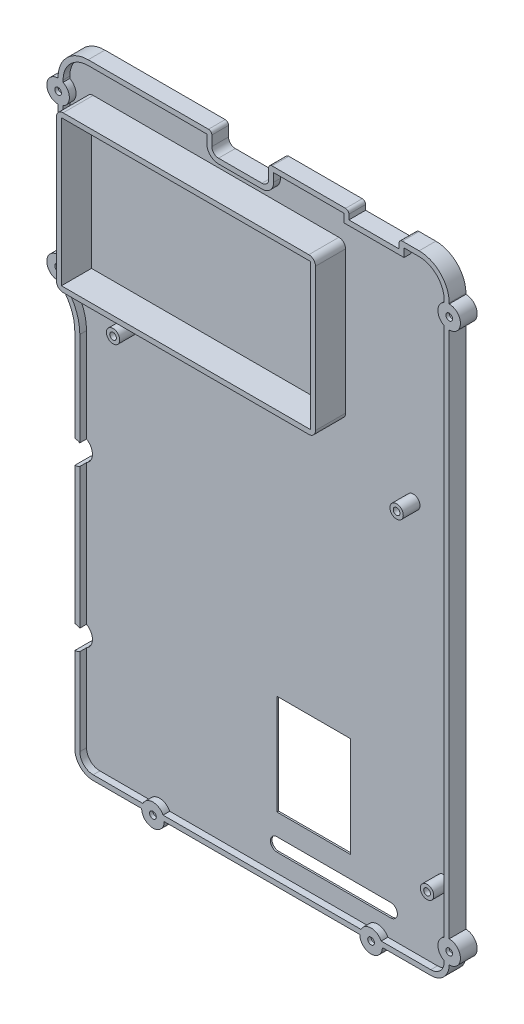
from build123d import *
from OCP.BRepAlgoAPI import BRepAlgoAPI_Cut
from OCP.TopTools import TopTools_ListOfShape

# Parameters (mm, degrees)
BOSS_EXTRUDE1_DEPTH = 0.5
EXTRUDE_THIN1_START = -3
EXTRUDE_THIN1_DEPTH = 3
EXTRUDE_THIN2_DEPTH = 2
BOSS_EXTRUDE3_START = -3
SKETCH2_11_R        = 3.375
BOSS_EXTRUDE3_DEPTH = 5
SKETCH13_R          = 1
CUT_EXTRUDE6_DEPTH  = 4
SKETCH14_R          = 2
CUT_EXTRUDE7_DEPTH  = 4
SKETCH16_W          = 77.5
SKETCH16_H          = 46.56
SKETCH16_W_2        = 74.5
SKETCH16_H_2        = 43.56
EXTRUDE_THIN5_DEPTH = 9
FILLET1_R           = 2
SKETCH17_W          = 22
SKETCH17_H          = 30
CUT_EXTRUDE8_DEPTH  = 9
CUT_EXTRUDE9_DEPTH  = 9
CUT_EXTRUDE10_START = -6
CUT_EXTRUDE10_DEPTH = 7
SKETCH20_R          = 2
SKETCH20_R_2        = 1
EXTRUDE_THIN6_DEPTH = 5


with BuildPart() as part:
    # Sketch2 → Boss-Extrude1 (new body)
    # profile 1 of 2: a face of its own
    with BuildSketch(Plane.XY):
        with BuildLine():
            Line((-13.5, 93), (-49.5, 93))
            ThreePointArc((-49.5, 93), (-55.863961031, 90.363961031), (-58.5, 84))
            Line((-58.5, 84), (-58.5, 83.73))
            ThreePointArc((-58.5, 83.73), (-56.113514613, 82.741485387), (-55.125, 80.355))
            ThreePointArc((-55.125, 80.355), (-56.113514613, 77.968514613), (-58.5, 76.98))
            Line((-58.5, 76.98), (-58.5, 37.986583357))
            ThreePointArc((-58.5, 37.986583357), (-56.113514613, 36.998068743), (-55.125, 34.611583357))
            ThreePointArc((-55.125, 34.611583357), (-56.113514613, 32.22509797), (-58.5, 31.236583357))
            ThreePointArc((-58.5, 31.236583357), (-54.81193931, 26.455924417), (-53.5, 20.562257748))
            Line((-53.5, 20.562257748), (-53.5, -87.5))
            ThreePointArc((-53.5, -87.5), (-51.889087297, -91.389087297), (-48, -93))
            Line((-48, -93), (-33.5, -93))
            ThreePointArc((-33.5, -93), (-30.125, -89.625), (-26.75, -93))
            Line((-26.75, -93), (31.75, -93))
            ThreePointArc((31.75, -93), (35.125, -89.625), (38.5, -93))
            Line((38.5, -93), (53, -93))
            ThreePointArc((53, -93), (56.889087297, -91.389087297), (58.5, -87.5))
            ThreePointArc((58.5, -87.5), (55.125, -84.125), (58.5, -80.75))
            Line((58.5, -80.75), (58.5, 20.562257748))
            Line((58.5, 20.562257748), (58.5, 76.986583357))
            ThreePointArc((58.5, 76.986583357), (55.131583357, 80.355), (58.5, 83.723416643))
            Line((58.5, 83.723416643), (58.5, 84))
            ThreePointArc((58.5, 84), (55.863961031, 90.363961031), (49.5, 93))
            Line((49.5, 93), (44.5, 93))
            ThreePointArc((44.5, 93), (43.792893219, 92.707106781), (43.5, 92))
            Line((43.5, 92), (43.5, 90.5))
            Line((43.5, 90.5), (28.5, 90.5))
            Line((28.5, 90.5), (28.5, 92))
            ThreePointArc((28.5, 92), (28.207106781, 92.707106781), (27.5, 93))
            Line((27.5, 93), (5.5, 93))
            ThreePointArc((5.5, 93), (4.792893219, 92.707106781), (4.5, 92))
            Line((4.5, 92), (4.5, 89))
            ThreePointArc((4.5, 89), (3.914213562, 87.585786438), (2.5, 87))
            Line((2.5, 87), (-10.5, 87))
            ThreePointArc((-10.5, 87), (-11.914213562, 87.585786438), (-12.5, 89))
            Line((-12.5, 89), (-12.5, 92))
            ThreePointArc((-12.5, 92), (-12.792893219, 92.707106781), (-13.5, 93))
        make_face()
        with BuildLine():
            ThreePointArc((-54, 81.62), (-53.414213562, 83.034213562), (-52, 83.62))
            Line((-52, 83.62), (22, 83.62))
            ThreePointArc((22, 83.62), (23.414213562, 83.034213562), (24, 81.62))
            Line((24, 81.62), (24, 39.07))
            ThreePointArc((24, 39.07), (23.414213562, 37.655786438), (22, 37.07))
            Line((22, 37.07), (-52, 37.07))
            ThreePointArc((-52, 37.07), (-53.414213562, 37.655786438), (-54, 39.07))
            Line((-54, 39.07), (-54, 81.62))
        make_face(mode=Mode.SUBTRACT)
    # profile 2 of 2: a face of its own
    with BuildSketch(Plane.XY):
        with BuildLine():
            Line((-52, 83.62), (22, 83.62))
            ThreePointArc((22, 83.62), (23.414213562, 83.034213562), (24, 81.62))
            Line((24, 81.62), (24, 39.07))
            ThreePointArc((24, 39.07), (23.414213562, 37.655786438), (22, 37.07))
            Line((22, 37.07), (-52, 37.07))
            ThreePointArc((-52, 37.07), (-53.414213562, 37.655786438), (-54, 39.07))
            Line((-54, 39.07), (-54, 81.62))
            ThreePointArc((-54, 81.62), (-53.414213562, 83.034213562), (-52, 83.62))
        make_face()
    extrude(amount=-BOSS_EXTRUDE1_DEPTH)

    # Extrude-Thin1: read off the stored shape, not the designer's step
    # Extrude-Thin1 outline → Extrude-Thin1 (add)
    with BuildSketch(Plane.XY.offset(EXTRUDE_THIN1_START)):
        with BuildLine():
            ThreePointArc((-58.5, 31.236583357), (-54.81193931, 26.455924417), (-53.5, 20.562257748))
            Line((-53.5, 20.562257748), (-53.5, -87.5))
            ThreePointArc((-53.5, -87.5), (-51.889087297, -91.389087297), (-48, -93))
            Line((-48, -93), (53, -93))
            ThreePointArc((53, -93), (56.889087297, -91.389087297), (58.5, -87.5))
            Line((58.5, -87.5), (58.5, 84))
            ThreePointArc((58.5, 84), (55.863961031, 90.363961031), (49.5, 93))
            Line((49.5, 93), (44.5, 93))
            ThreePointArc((44.5, 93), (43.792893219, 92.707106781), (43.5, 92))
            Line((43.5, 92), (43.5, 90.5))
            Line((43.5, 90.5), (28.5, 90.5))
            Line((28.5, 90.5), (28.5, 92))
            ThreePointArc((28.5, 92), (28.207106781, 92.707106781), (27.5, 93))
            Line((27.5, 93), (5.5, 93))
            ThreePointArc((5.5, 93), (4.792893219, 92.707106781), (4.5, 92))
            Line((4.5, 92), (4.5, 89))
            ThreePointArc((4.5, 89), (3.914213562, 87.585786438), (2.5, 87))
            Line((2.5, 87), (-10.5, 87))
            ThreePointArc((-10.5, 87), (-11.914213562, 87.585786438), (-12.5, 89))
            Line((-12.5, 89), (-12.5, 92))
            ThreePointArc((-12.5, 92), (-12.792893219, 92.707106781), (-13.5, 93))
            Line((-13.5, 93), (-49.5, 93))
            ThreePointArc((-49.5, 93), (-55.863961031, 90.363961031), (-58.5, 84))
            Line((-58.5, 84), (-58.5, 37.986583357))
            ThreePointArc((-58.5, 37.986583357), (-61.875, 34.611583357), (-58.5, 31.236583357))
        make_face()
        with BuildLine():
            ThreePointArc((-52, 20.562257748), (-53.593851785, 27.383660567), (-58.045363841, 32.792536638))
            ThreePointArc((-58.045363841, 32.792536638), (-60.266919183, 35.238976058), (-57, 35.736583357))
            Line((-57, 35.736583357), (-57, 84))
            ThreePointArc((-57, 84), (-54.803300859, 89.303300859), (-49.5, 91.5))
            Line((-49.5, 91.5), (-14, 91.5))
            Line((-14, 91.5), (-14, 89))
            ThreePointArc((-14, 89), (-12.974873734, 86.525126266), (-10.5, 85.5))
            Line((-10.5, 85.5), (2.5, 85.5))
            ThreePointArc((2.5, 85.5), (4.974873734, 86.525126266), (6, 89))
            Line((6, 89), (6, 91.5))
            Line((6, 91.5), (27, 91.5))
            Line((27, 91.5), (27, 89))
            Line((27, 89), (45, 89))
            Line((45, 89), (45, 91.5))
            Line((45, 91.5), (49.5, 91.5))
            ThreePointArc((49.5, 91.5), (54.803300859, 89.303300859), (57, 84))
            Line((57, 84), (57, -87.5))
            ThreePointArc((57, -87.5), (55.828427125, -90.328427125), (53, -91.5))
            Line((53, -91.5), (-48, -91.5))
            ThreePointArc((-48, -91.5), (-50.828427125, -90.328427125), (-52, -87.5))
            Line((-52, -87.5), (-52, 20.562257748))
        make_face(mode=Mode.SUBTRACT)
    extrude(amount=EXTRUDE_THIN1_DEPTH)



with BuildPart() as body_2:
    # Extrude-Thin2: read off the stored shape, not the designer's step
    # Extrude-Thin2 outline → Extrude-Thin2 (new body)
    with BuildSketch(Plane.XY):
        with BuildLine():
            ThreePointArc((-58.5, 37.986583357), (-61.875, 34.611583357), (-58.5, 31.236583357))
            ThreePointArc((-58.5, 31.236583357), (-54.81193931, 26.455924417), (-53.5, 20.562257748))
            Line((-53.5, 20.562257748), (-53.5, -87.5))
            ThreePointArc((-53.5, -87.5), (-51.889087297, -91.389087297), (-48, -93))
            Line((-48, -93), (53, -93))
            ThreePointArc((53, -93), (56.889087297, -91.389087297), (58.5, -87.5))
            Line((58.5, -87.5), (58.5, 84))
            ThreePointArc((58.5, 84), (55.863961031, 90.363961031), (49.5, 93))
            Line((49.5, 93), (44.5, 93))
            ThreePointArc((44.5, 93), (43.792893219, 92.707106781), (43.5, 92))
            Line((43.5, 92), (43.5, 90.5))
            Line((43.5, 90.5), (28.5, 90.5))
            Line((28.5, 90.5), (28.5, 92))
            ThreePointArc((28.5, 92), (28.207106781, 92.707106781), (27.5, 93))
            Line((27.5, 93), (5.5, 93))
            ThreePointArc((5.5, 93), (4.792893219, 92.707106781), (4.5, 92))
            Line((4.5, 92), (4.5, 89))
            ThreePointArc((4.5, 89), (3.914213562, 87.585786438), (2.5, 87))
            Line((2.5, 87), (-10.5, 87))
            ThreePointArc((-10.5, 87), (-11.914213562, 87.585786438), (-12.5, 89))
            Line((-12.5, 89), (-12.5, 92))
            ThreePointArc((-12.5, 92), (-12.792893219, 92.707106781), (-13.5, 93))
            Line((-13.5, 93), (-49.5, 93))
            ThreePointArc((-49.5, 93), (-55.863961031, 90.363961031), (-58.5, 84))
            Line((-58.5, 84), (-58.5, 37.986583357))
        make_face()
        with BuildLine():
            ThreePointArc((-52, 20.562257748), (-53.593851785, 27.383660567), (-58.045363841, 32.792536638))
            ThreePointArc((-58.045363841, 32.792536638), (-60.266919183, 35.238976058), (-57, 35.736583357))
            Line((-57, 35.736583357), (-57, 84))
            ThreePointArc((-57, 84), (-54.803300859, 89.303300859), (-49.5, 91.5))
            Line((-49.5, 91.5), (-14, 91.5))
            Line((-14, 91.5), (-14, 89))
            ThreePointArc((-14, 89), (-12.974873734, 86.525126266), (-10.5, 85.5))
            Line((-10.5, 85.5), (2.5, 85.5))
            ThreePointArc((2.5, 85.5), (4.974873734, 86.525126266), (6, 89))
            Line((6, 89), (6, 91.5))
            Line((6, 91.5), (27, 91.5))
            Line((27, 91.5), (27, 89))
            Line((27, 89), (45, 89))
            Line((45, 89), (45, 91.5))
            Line((45, 91.5), (49.5, 91.5))
            ThreePointArc((49.5, 91.5), (54.803300859, 89.303300859), (57, 84))
            Line((57, 84), (57, -87.5))
            ThreePointArc((57, -87.5), (55.828427125, -90.328427125), (53, -91.5))
            Line((53, -91.5), (-48, -91.5))
            ThreePointArc((-48, -91.5), (-50.828427125, -90.328427125), (-52, -87.5))
            Line((-52, -87.5), (-52, 20.562257748))
        make_face(mode=Mode.SUBTRACT)
    extrude(amount=EXTRUDE_THIN2_DEPTH)


with BuildPart() as part_1:
    add(part.part)

    add(body_2.part)  # Boss-Extrude3 merges body 2
    # Sketch2<11> → Boss-Extrude3 (add)
    with BuildSketch(Plane.XY.offset(BOSS_EXTRUDE3_START)):
        with BuildLine():
            ThreePointArc((61.868416643, 80.355), (60.88183025, 82.73683025), (58.5, 83.723416643))
            Line((58.5, 83.723416643), (58.5, 76.986583357))
            ThreePointArc((58.5, 76.986583357), (60.88183025, 77.97316975), (61.868416643, 80.355))
        make_face()
        with BuildLine():
            Line((58.5, 76.986583357), (58.5, 83.723416643))
            ThreePointArc((58.5, 83.723416643), (55.131583357, 80.355), (58.5, 76.986583357))
        make_face()
        with Locations((-58.5, 34.611583357)):
            Circle(SKETCH2_11_R)
        with BuildLine():
            ThreePointArc((38.5, -93), (35.125, -89.625), (31.75, -93))
            Line((31.75, -93), (38.5, -93))
        make_face()
        with BuildLine():
            Line((38.5, -93), (31.75, -93))
            ThreePointArc((31.75, -93), (35.125, -96.375), (38.5, -93))
        make_face()
        with BuildLine():
            ThreePointArc((-26.75, -93), (-30.125, -89.625), (-33.5, -93))
            Line((-33.5, -93), (-26.75, -93))
        make_face()
        with BuildLine():
            Line((-26.75, -93), (-33.5, -93))
            ThreePointArc((-33.5, -93), (-30.125, -96.375), (-26.75, -93))
        make_face()
        with BuildLine():
            ThreePointArc((58.5, -80.75), (55.125, -84.125), (58.5, -87.5))
            Line((58.5, -87.5), (58.5, -80.75))
        make_face()
        with BuildLine():
            Line((58.5, -80.75), (58.5, -87.5))
            ThreePointArc((58.5, -87.5), (60.886485387, -86.511485387), (61.875, -84.125))
            ThreePointArc((61.875, -84.125), (60.886485387, -81.738514613), (58.5, -80.75))
        make_face()
        with Locations((-58.5, 80.355)):
            Circle(SKETCH2_11_R)
    extrude(amount=BOSS_EXTRUDE3_DEPTH)

    # Sketch13 → Cut-Extrude6 (cut)
    with BuildSketch(Plane.XY.offset(2)):
        with Locations((-58.5, 80.355)):
            Circle(SKETCH13_R)
        with Locations((58.5, 80.355)):
            Circle(SKETCH13_R)
        with Locations((58.5, -84.125)):
            Circle(SKETCH13_R)
        with Locations((35.125, -93)):
            Circle(SKETCH13_R)
        with Locations((-30.125, -93)):
            Circle(SKETCH13_R)
        with Locations((-58.5, 34.611583357)):
            Circle(SKETCH13_R)
    extrude(amount=-CUT_EXTRUDE6_DEPTH, mode=Mode.SUBTRACT)

    # Sketch14 → Cut-Extrude7 (cut)
    with BuildSketch(Plane(origin=(0, 0, -3), x_dir=(-1, 0, 0), z_dir=(0, 0, -1))):
        with Locations((-58.5, 80.355)):
            Circle(SKETCH14_R)
        with Locations((-58.5, -84.125)):
            Circle(SKETCH14_R)
        with Locations((-35.125, -93)):
            Circle(SKETCH14_R)
        with Locations((30.125, -93)):
            Circle(SKETCH14_R)
        with Locations((58.5, 34.611583357)):
            Circle(SKETCH14_R)
        with Locations((58.5, 80.355)):
            Circle(SKETCH14_R)
    extrude(amount=-CUT_EXTRUDE7_DEPTH, mode=Mode.SUBTRACT)

    # Sketch16 → Extrude-Thin5 (add)
    with BuildSketch(Plane.XY):
        with Locations((-13.25, 59.22)):
            Rectangle(SKETCH16_W, SKETCH16_H)
        with Locations((-13.25, 59.22)):
            Rectangle(SKETCH16_W_2, SKETCH16_H_2, mode=Mode.SUBTRACT)
    extrude(amount=EXTRUDE_THIN5_DEPTH)

    # Fillet1
    fillet1_edges = [part_1.edges().sort_by_distance(p)[0] for p in [
        (-52, 82.5, 4.5),
        (-52, 35.94, 4.5),
        (25.5, 35.94, 4.5),
        (25.5, 82.5, 4.5),
    ]]
    fillet(fillet1_edges, radius=FILLET1_R)

    # Sketch17 → Cut-Extrude8 (cut)
    with BuildSketch(Plane.XY):
        with Locations((16, -60.66)):
            Rectangle(SKETCH17_W, SKETCH17_H)
    extrude(amount=-CUT_EXTRUDE8_DEPTH, mode=Mode.SUBTRACT)

    # Sketch18 → Cut-Extrude9 (cut)
    with BuildSketch(Plane.XY):
        with BuildLine():
            Line((5, -82.072424205), (39, -82.072424205))
            ThreePointArc((39, -82.072424205), (41, -84.072424205), (39, -86.072424205))
            Line((39, -86.072424205), (5, -86.072424205))
            ThreePointArc((5, -86.072424205), (3, -84.072424205), (5, -82.072424205))
        make_face()
    extrude(amount=-CUT_EXTRUDE9_DEPTH, mode=Mode.SUBTRACT)


with BuildPart() as cut_extrude10_tool:
    # Cut-Extrude10: read off the stored shape, not the designer's step
    # Cut-Extrude10 outline → Cut-Extrude10 (new body)
    with BuildSketch(Plane(origin=(0, 0, -3), x_dir=(-1, 0, 0), z_dir=(0, 0, -1)).offset(CUT_EXTRUDE10_START)):
        with BuildLine():
            Line((53.499992735, -14.070133865), (53.5, -7.071559179))
            ThreePointArc((53.5, -7.071559179), (50.232046152, -10.57084313), (53.499992735, -14.070133865))
        make_face()
        with BuildLine():
            Line((53.5, -62.045153461), (53.5, -55.06055482))
            ThreePointArc((53.5, -55.06055482), (50.232046238, -58.552854141), (53.5, -62.045153461))
        make_face()
    extrude(amount=CUT_EXTRUDE10_DEPTH)


with BuildPart() as part_2:
    add(part_1.part)

    # Cut-Extrude10: cut by cut_extrude10_tool, with a tolerance
    cut_extrude10_stock = TopTools_ListOfShape()
    cut_extrude10_stock.Append(part_2.part.wrapped)
    cut_extrude10_tools = TopTools_ListOfShape()
    cut_extrude10_tools.Append(cut_extrude10_tool.part.wrapped)
    cut_extrude10_cut = BRepAlgoAPI_Cut()
    cut_extrude10_cut.SetArguments(cut_extrude10_stock)
    cut_extrude10_cut.SetTools(cut_extrude10_tools)
    cut_extrude10_cut.SetFuzzyValue(0.00001)
    cut_extrude10_cut.Build()
    add(Compound.cast(cut_extrude10_cut.Shape()).solids(), mode=Mode.REPLACE)

    # Sketch20 → Extrude-Thin6 (add)
    # profile 1 of 3: a face of its own
    with BuildSketch(Plane.XY):
        with Locations((54.870141122, -68.907445852)):
            Circle(SKETCH20_R)
        with Locations((54.870141122, -68.907445852)):
            Circle(SKETCH20_R_2, mode=Mode.SUBTRACT)
    # profile 2 of 3: a face of its own
    with BuildSketch(Plane.XY):
        with Locations((45.762484634, 25.114408221)):
            Circle(SKETCH20_R)
        with Locations((45.762484634, 25.114408221)):
            Circle(SKETCH20_R_2, mode=Mode.SUBTRACT)
    # profile 3 of 3: a face of its own
    with BuildSketch(Plane.XY):
        with Locations((-39.051925297, 28.114408221)):
            Circle(SKETCH20_R)
        with Locations((-39.051925297, 28.114408221)):
            Circle(SKETCH20_R_2, mode=Mode.SUBTRACT)
    extrude(amount=EXTRUDE_THIN6_DEPTH)


solid = part_2.part
